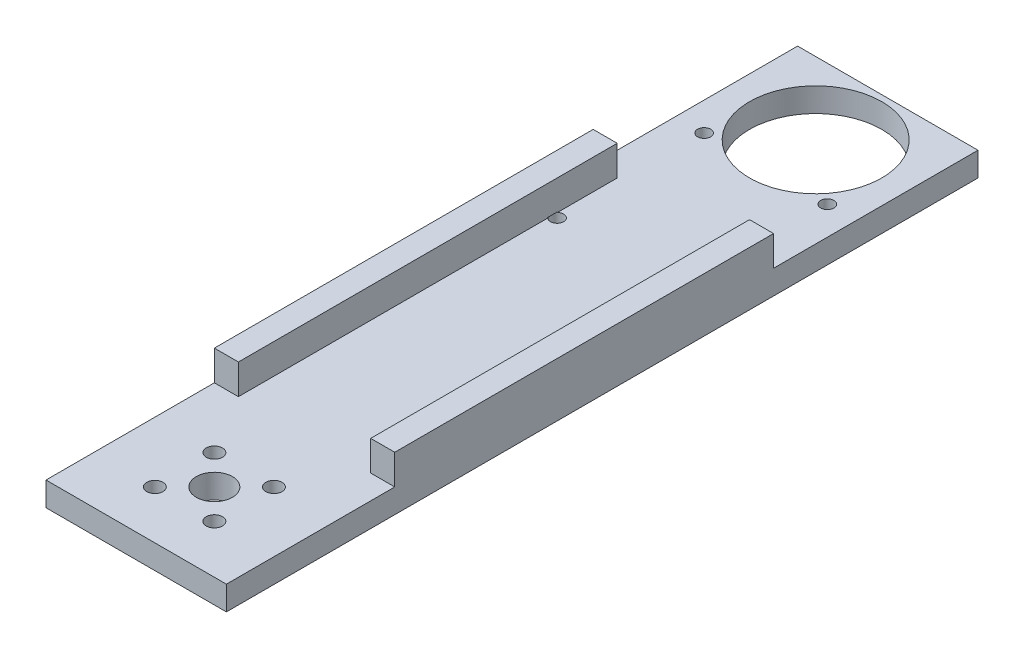
from build123d import *

# Parameters (mm, degrees)
S_BOX1_W      = 30
S_BOX1_H      = 4
BOSS_1_DEPTH  = 125
S_BOX2_W      = 4
S_BOX2_H      = 5.5
BOSS_2_DEPTH  = 63
S_BOX3_W      = 4
S_BOX3_H      = 5.5
BOSS_3_DEPTH  = 63
S_HOLE4_R     = 3
HOLE_4_DEPTH  = 4.2
S_HOLE5_R     = 1.35
HOLE_5_DEPTH  = 4.2
S_HOLE6_R     = 1.35
HOLE_6_DEPTH  = 4.2
S_HOLE7_R     = 1.35
HOLE_7_DEPTH  = 4.2
S_HOLE8_R     = 1.35
HOLE_8_DEPTH  = 4.2
S_HOLE9_R     = 11
HOLE_9_DEPTH  = 4.2
S_HOLE10_R    = 1.1
HOLE_10_DEPTH = 4.2
S_HOLE11_R    = 1.1
HOLE_11_DEPTH = 4.2
S_HOLE12_R    = 1.1
HOLE_12_DEPTH = 4.2
S_HOLE13_R    = 1.1
HOLE_13_DEPTH = 4.2


with BuildPart() as part:
    # S_box1 → Boss_1 (new body)
    with BuildSketch(Plane.XY.offset(-112)):
        with Locations((0, 18)):
            Rectangle(S_BOX1_W, S_BOX1_H)
    extrude(amount=BOSS_1_DEPTH)

    # S_box2 → Boss_2 (add)
    with BuildSketch(Plane.XY.offset(-78)):
        with Locations((-13, 22.25)):
            Rectangle(S_BOX2_W, S_BOX2_H)
    extrude(amount=BOSS_2_DEPTH)

    # S_box3 → Boss_3 (add)
    with BuildSketch(Plane.XY.offset(-78)):
        with Locations((13, 22.25)):
            Rectangle(S_BOX3_W, S_BOX3_H)
    extrude(amount=BOSS_3_DEPTH)

    # S_hole4 → Hole_4 (cut)
    with BuildSketch(Plane(origin=(0, 15.9, 0), x_dir=(1, 0, 0), z_dir=(0, 1, 0))):
        Circle(S_HOLE4_R)
    extrude(amount=HOLE_4_DEPTH, mode=Mode.SUBTRACT)

    # S_hole5 → Hole_5 (cut)
    with BuildSketch(Plane(origin=(0, 15.9, 0), x_dir=(1, 0, 0), z_dir=(0, 1, 0))):
        with Locations((4.949747468, -4.949747468)):
            Circle(S_HOLE5_R)
    extrude(amount=HOLE_5_DEPTH, mode=Mode.SUBTRACT)

    # S_hole6 → Hole_6 (cut)
    with BuildSketch(Plane(origin=(0, 15.9, 0), x_dir=(1, 0, 0), z_dir=(0, 1, 0))):
        with Locations((-4.949747468, -4.949747468)):
            Circle(S_HOLE6_R)
    extrude(amount=HOLE_6_DEPTH, mode=Mode.SUBTRACT)

    # S_hole7 → Hole_7 (cut)
    with BuildSketch(Plane(origin=(0, 15.9, 0), x_dir=(1, 0, 0), z_dir=(0, 1, 0))):
        with Locations((-4.949747468, 4.949747468)):
            Circle(S_HOLE7_R)
    extrude(amount=HOLE_7_DEPTH, mode=Mode.SUBTRACT)

    # S_hole8 → Hole_8 (cut)
    with BuildSketch(Plane(origin=(0, 15.9, 0), x_dir=(1, 0, 0), z_dir=(0, 1, 0))):
        with Locations((4.949747468, 4.949747468)):
            Circle(S_HOLE8_R)
    extrude(amount=HOLE_8_DEPTH, mode=Mode.SUBTRACT)

    # S_hole9 → Hole_9 (cut)
    with BuildSketch(Plane(origin=(0, 15.9, 0), x_dir=(1, 0, 0), z_dir=(0, 1, 0))):
        with Locations((0, 100)):
            Circle(S_HOLE9_R)
    extrude(amount=HOLE_9_DEPTH, mode=Mode.SUBTRACT)

    # S_hole10 → Hole_10 (cut)
    with BuildSketch(Plane(origin=(0, 15.9, 0), x_dir=(1, 0, 0), z_dir=(0, 1, 0))):
        with Locations((-10.25, 91.7)):
            Circle(S_HOLE10_R)
    extrude(amount=HOLE_10_DEPTH, mode=Mode.SUBTRACT)

    # S_hole11 → Hole_11 (cut)
    with BuildSketch(Plane(origin=(0, 15.9, 0), x_dir=(1, 0, 0), z_dir=(0, 1, 0))):
        with Locations((10.25, 91.7)):
            Circle(S_HOLE11_R)
    extrude(amount=HOLE_11_DEPTH, mode=Mode.SUBTRACT)

    # S_hole12 → Hole_12 (cut)
    with BuildSketch(Plane(origin=(0, 15.9, 0), x_dir=(1, 0, 0), z_dir=(0, 1, 0))):
        with Locations((-10.25, 67.25)):
            Circle(S_HOLE12_R)
    extrude(amount=HOLE_12_DEPTH, mode=Mode.SUBTRACT)

    # S_hole13 → Hole_13 (cut)
    with BuildSketch(Plane(origin=(0, 15.9, 0), x_dir=(1, 0, 0), z_dir=(0, 1, 0))):
        with Locations((10.25, 67.25)):
            Circle(S_HOLE13_R)
    extrude(amount=HOLE_13_DEPTH, mode=Mode.SUBTRACT)


solid = part.part
